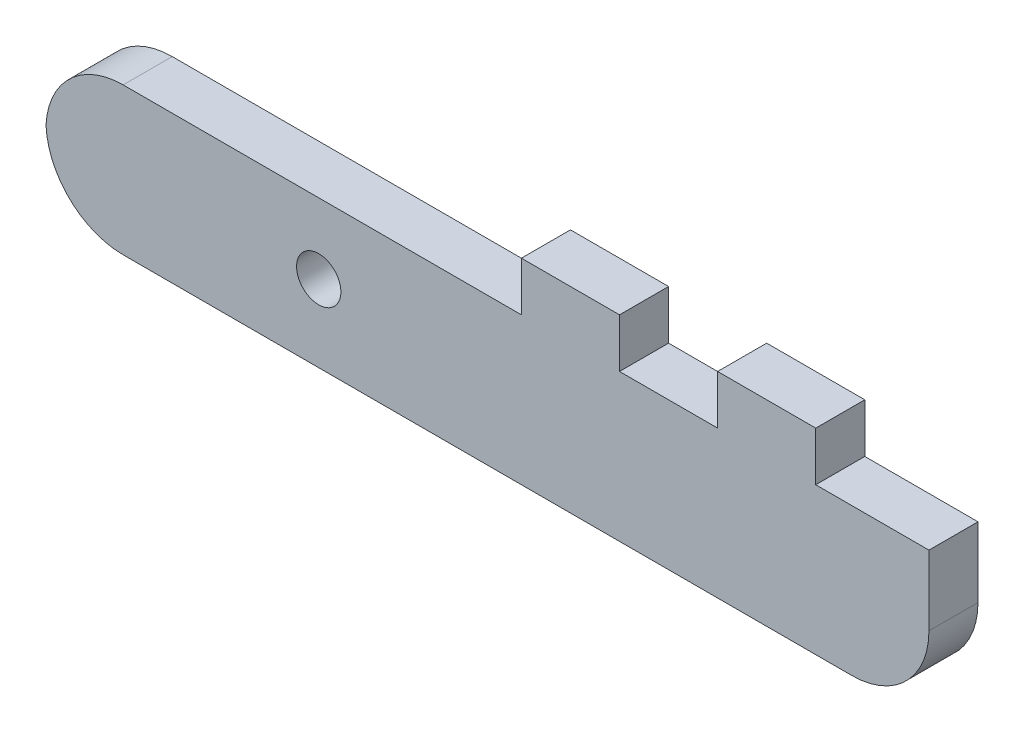
from build123d import *

# Parameters (mm, degrees)
BOSS_EXTRUDE1_DEPTH = 6.35
FILLET1_R           = 10
SKETCH2_R           = 2.8702
CUT_EXTRUDE1_DEPTH  = 81.739915371


with BuildPart() as part:
    # Sketch1 → Boss-Extrude1 (new body)
    with BuildSketch(Plane.XY):
        Polygon((26.235565231, 15.475), (38.935565231, 15.475), (38.935565231, 9.125), (51.635565231, 9.125), (51.635565231, 15.475), (64.335565231, 15.475), (64.335565231, 9.125), (78.988200442, 9.125), (78.988200442, -9.925), (-35.311799558, -9.925), (-35.311799558, 9.125), (26.235565231, 9.125), align=None)
    extrude(amount=BOSS_EXTRUDE1_DEPTH)

    # Fillet1
    # the kernel refuses this fillet: 10 mm, written as the material it takes off along each edge
    with BuildSketch(Plane(origin=(78.988200442, -9.925, -25), x_dir=(0, 1, 0), z_dir=(0, 0, 1)), Plane(origin=(-35.311799558, 9.125, -25), x_dir=(0, -1, 0), z_dir=(0, 0, 1)), Plane(origin=(-35.311799558, -9.925, -25), x_dir=(1, 0, 0), z_dir=(0, 0, 1))) as fillet1_piece_1:
        with BuildLine():
            CenterArc((FILLET1_R, FILLET1_R), FILLET1_R, 180, 90)
            Line((0, FILLET1_R), (0, 0))
            Line((0, 0), (FILLET1_R, 0))
        make_face()
    extrude(amount=56.35, mode=Mode.SUBTRACT)

    # Sketch2 → Cut-Extrude1 (cut, through all)
    with BuildSketch(Plane.XY.offset(6.35)):
        Circle(SKETCH2_R)
    extrude(amount=-CUT_EXTRUDE1_DEPTH, mode=Mode.SUBTRACT)


solid = part.part
